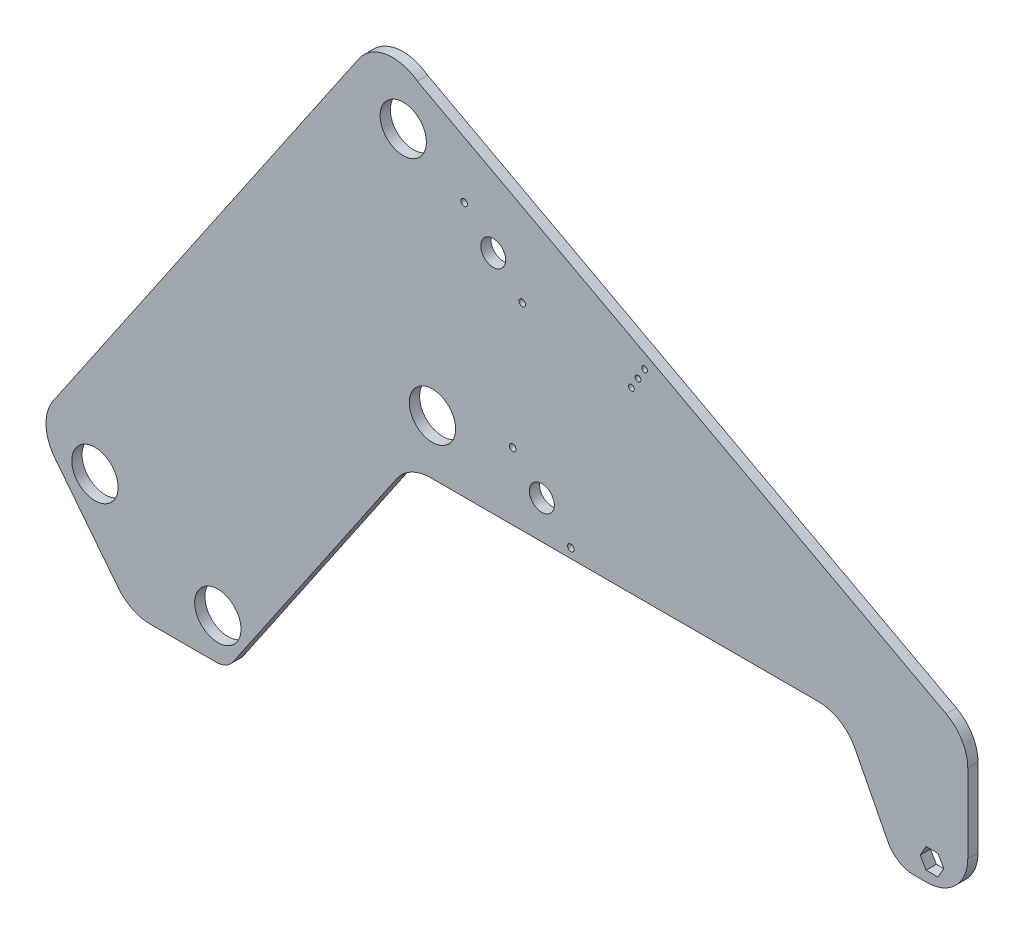
from build123d import *

# Parameters (mm, degrees)
MODEL_R             = 14.351
MODEL_R_2           = 2.032
MODEL_R_3           = 7.747
MODEL_R_4           = 1.778
BOSS_EXTRUDE1_DEPTH = 6.35


with BuildPart() as part:
    # Model → Boss-Extrude1 (new body)
    with BuildSketch(Plane.XY):
        with BuildLine():
            ThreePointArc((-212.899365952, 93.541257838), (-203.778989185, 101.701881024), (-191.901103209, 104.650248016))
            Line((-191.901103209, 104.650248016), (48.661197018, 104.650248016))
            ThreePointArc((48.661197018, 104.650248016), (61.901986038, 100.926075708), (71.260020742, 90.8456422))
            Line((71.260020742, 90.8456422), (91.800416921, 50.813472087))
            ThreePointArc((91.800416921, 50.813472087), (98.351041215, 43.757168632), (107.619593528, 41.150248016))
            Line((107.619593528, 41.150248016), (115.808590566, 41.150248016))
            ThreePointArc((115.808590566, 41.150248016), (133.769102808, 48.589735774), (141.208590566, 66.550248016))
            Line((141.208590566, 66.550248016), (141.208590566, 115.30333804))
            ThreePointArc((141.208590566, 115.30333804), (137.602779127, 128.348388632), (127.809114586, 137.689660276))
            Line((127.809114586, 137.689660276), (-200.005250584, 313.419470721))
            ThreePointArc((-200.005250584, 313.419470721), (-219.438743814, 318.210854709), (-236.308771814, 307.439588539))
            Line((-236.308771814, 307.439588539), (-425.925316767, 28.829603592))
            ThreePointArc((-425.925316767, 28.829603592), (-430.312243104, 13.671313347), (-424.900993017, -1.152223962))
            Line((-424.900993017, -1.152223962), (-385.581467186, -51.204797614))
            ThreePointArc((-385.581467186, -51.204797614), (-376.711879358, -58.358090396), (-365.607528193, -60.913979882))
            Line((-365.607528193, -60.913979882), (-324.737451002, -60.913979882))
            ThreePointArc((-324.737451002, -60.913979882), (-318.798508014, -59.439796386), (-314.23831963, -55.359484793))
            Line((-314.23831963, -55.359484793), (-212.899365952, 93.541257838))
        make_face()
        with Locations((-323.775189267, -35.513979882)):
            Circle(MODEL_R, mode=Mode.SUBTRACT)
        with Locations((-399.975189267, 2.586020118)):
            Circle(MODEL_R, mode=Mode.SUBTRACT)
        with BuildLine():
            ThreePointArc((-106.906627247, 110.457357488), (-106.315772458, 111.902007888), (-104.874663217, 112.501447888))
            ThreePointArc((-104.874663217, 112.501447888), (-103.433553975, 109.036887888), (-106.906627247, 110.457357488))
        make_face(mode=Mode.SUBTRACT)
        Polygon((122.716975548, 60.200248016), (126.383149757, 53.850248016), (122.716975548, 47.500248016), (115.384627129, 47.500248016), (111.71845292, 53.850248016), (115.384627129, 60.200248016), align=None, mode=Mode.SUBTRACT)
        with Locations((-190.707148919, 138.516914683)):
            Circle(MODEL_R, mode=Mode.SUBTRACT)
        with Locations((-140.902394258, 146.283447888)):
            Circle(MODEL_R_2, mode=Mode.SUBTRACT)
        with Locations((-122.888528737, 128.249447888)):
            Circle(MODEL_R_3, mode=Mode.SUBTRACT)
        with Locations((-67.327857484, 215.218777602)):
            Circle(MODEL_R_4, mode=Mode.SUBTRACT)
        with Locations((-63.232560678, 222.239669858)):
            Circle(MODEL_R_4, mode=Mode.SUBTRACT)
        with BuildLine():
            ThreePointArc((-137.040511204, 226.962594218), (-136.449656415, 228.407244618), (-135.008547173, 229.006684618))
            ThreePointArc((-135.008547173, 229.006684618), (-133.567437931, 225.542124618), (-137.040511204, 226.962594218))
        make_face(mode=Mode.SUBTRACT)
        with Locations((-153.022412694, 244.754684618)):
            Circle(MODEL_R_3, mode=Mode.SUBTRACT)
        with Locations((-171.036278215, 262.788684618)):
            Circle(MODEL_R_2, mode=Mode.SUBTRACT)
        with Locations((-59.137263873, 229.260562114)):
            Circle(MODEL_R_4, mode=Mode.SUBTRACT)
        with Locations((-208.832932893, 283.437784316)):
            Circle(MODEL_R, mode=Mode.SUBTRACT)
    extrude(amount=BOSS_EXTRUDE1_DEPTH)


solid = part.part
